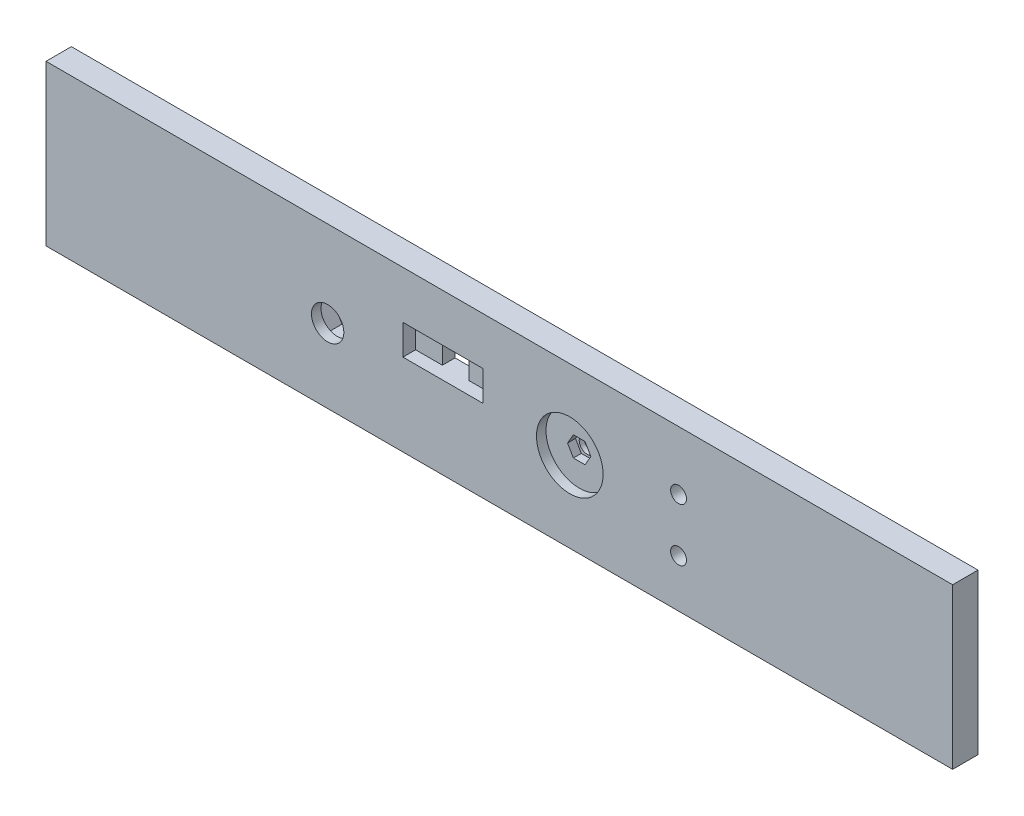
from build123d import *

# Parameters (mm, degrees)
SKETCH1_W                  = 571.5
SKETCH1_H                  = 100.8
BOSS_EXTRUDE1_DEPTH        = 8
SKETCH4_R                  = 7.5
CUT_EXTRUDE3_DEPTH         = 2
SKETCH5_R                  = 5
CUT_EXTRUDE4_DEPTH         = 581.490215249
CUT_EXTRUDE5_DEPTH         = 11
SKETCH9_R                  = 10.2
SKETCH9_R_2                = 5
POWER_AND_USB_CABLES_DEPTH = 581.541893406
SKETCH10_R                 = 21
CUT_EXTRUDE6_DEPTH         = 6
CUT_EXTRUDE8_DEPTH         = 10
CUT_EXTRUDE9_DEPTH         = 581.541893406
CUT_EXTRUDE9_DEPTH_BACK    = 581.541893406
SKETCH13_W                 = 16.7
SKETCH13_H                 = 19
SKETCH14_W                 = 50.4
SKETCH14_H                 = 19
CUT_EXTRUDE10_DEPTH        = 8


with BuildPart() as part:
    # Sketch1 → Boss-Extrude1 (new, symmetric)
    with BuildSketch(Plane.XY):
        with Locations((285.75, 50.4)):
            Rectangle(SKETCH1_W, SKETCH1_H)
    extrude(amount=BOSS_EXTRUDE1_DEPTH, both=True)

    # Sketch4 → Cut-Extrude3 (cut)
    with BuildSketch(Plane(origin=(0, 0, -8), x_dir=(-1, 0, 0), z_dir=(0, 0, -1))):
        with Locations((-330.123617772, 50.8)):
            Circle(SKETCH4_R)
    extrude(amount=-CUT_EXTRUDE3_DEPTH, mode=Mode.SUBTRACT)

    # Sketch5 → Cut-Extrude4 (cut, through all)
    with BuildSketch(Plane(origin=(0, 0, -6), x_dir=(-1, 0, 0), z_dir=(0, 0, -1))):
        with Locations((-330.123617772, 50.8)):
            Circle(SKETCH5_R)
    extrude(amount=-CUT_EXTRUDE4_DEPTH, mode=Mode.SUBTRACT)

    # Sketch6 → Cut-Extrude5 (cut)
    with BuildSketch(Plane.XY.offset(8)):
        Polygon((337.467513196, 50.8), (333.795565484, 57.16), (326.45167006, 57.16), (322.779722348, 50.8), (326.45167006, 44.44), (333.795565484, 44.44), align=None)
    extrude(amount=-CUT_EXTRUDE5_DEPTH, mode=Mode.SUBTRACT)

    # Sketch9 → power and usb cables (cut, through all)
    with BuildSketch(Plane.XY.offset(8)):
        with Locations((177.536724471, 46.600039321)):
            Circle(SKETCH9_R)
        with Locations((398.740788678, 63.702792605)):
            Circle(SKETCH9_R_2)
        with Locations((398.740788678, 30.252024765)):
            Circle(SKETCH9_R_2)
    extrude(amount=-POWER_AND_USB_CABLES_DEPTH, mode=Mode.SUBTRACT)

    # Sketch10 → Cut-Extrude6 (cut)
    with BuildSketch(Plane.XY.offset(8)):
        with Locations((330.16394587, 50.821844921)):
            Circle(SKETCH10_R)
    extrude(amount=-CUT_EXTRUDE6_DEPTH, mode=Mode.SUBTRACT)

    # Sketch12 → Cut-Extrude8 (cut)
    with BuildSketch(Plane(origin=(0, 0, -8), x_dir=(-1, 0, 0), z_dir=(0, 0, -1))):
        Polygon((-163.68031801, 46.600039321), (-170.608521241, 58.600039321), (-184.464927701, 58.600039321), (-191.393130932, 46.600039321), (-184.464927701, 34.600039321), (-170.608521241, 34.600039321), align=None)
    extrude(amount=-CUT_EXTRUDE8_DEPTH, mode=Mode.SUBTRACT)

    # Sketch13 → Cut-Extrude9 (cut, two sides: drawn at the far end of the back side and taken through both)
    with BuildSketch(Plane(origin=(0, 0, -8), x_dir=(-1, 0, 0), z_dir=(0, 0, -1)).offset(-CUT_EXTRUDE9_DEPTH_BACK)):
        with Locations((-250.2, 61.3)):
            Rectangle(SKETCH13_W, SKETCH13_H)
    extrude(amount=CUT_EXTRUDE9_DEPTH + CUT_EXTRUDE9_DEPTH_BACK, mode=Mode.SUBTRACT)

    # Sketch14 → Cut-Extrude10 (cut)
    with BuildSketch(Plane.XY.offset(8)):
        with Locations((250.2, 61.3)):
            Rectangle(SKETCH14_W, SKETCH14_H)
    extrude(amount=-CUT_EXTRUDE10_DEPTH, mode=Mode.SUBTRACT)


solid = part.part
